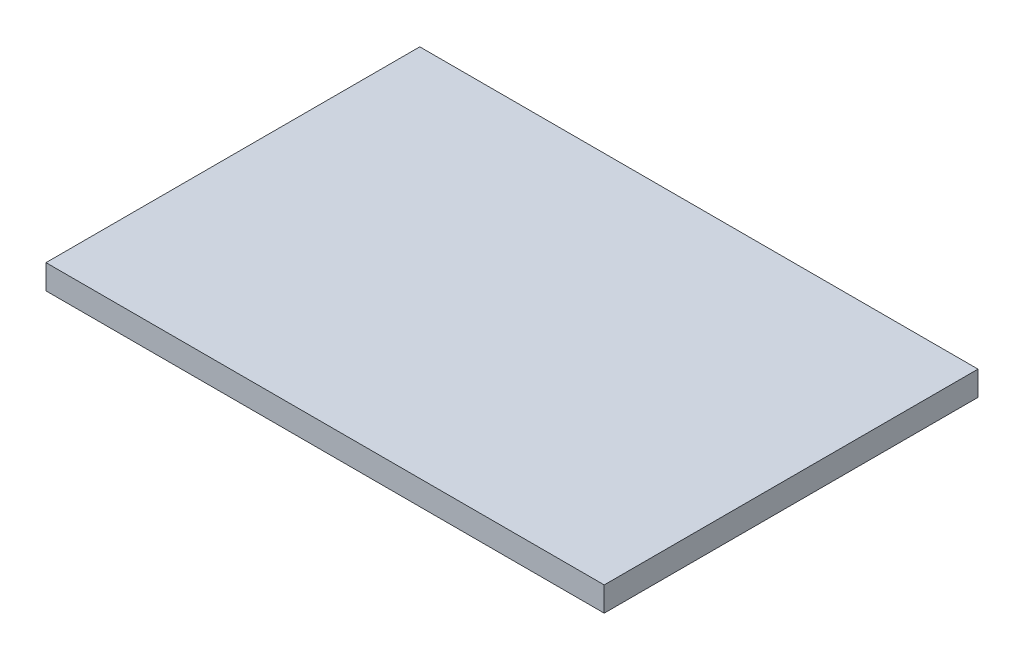
from build123d import *

# Parameters (mm, degrees)
SKETCH1_W           = 68.4
SKETCH1_H           = 45.8
BOSS_EXTRUDE1_DEPTH = 3


with BuildPart() as part:
    # Sketch1 → Boss-Extrude1 (new body)
    with BuildSketch(Plane(origin=(0, 0, 0), x_dir=(1, 0, 0), z_dir=(0, 1, 0))):
        Rectangle(SKETCH1_W, SKETCH1_H)
    extrude(amount=BOSS_EXTRUDE1_DEPTH)


solid = part.part
